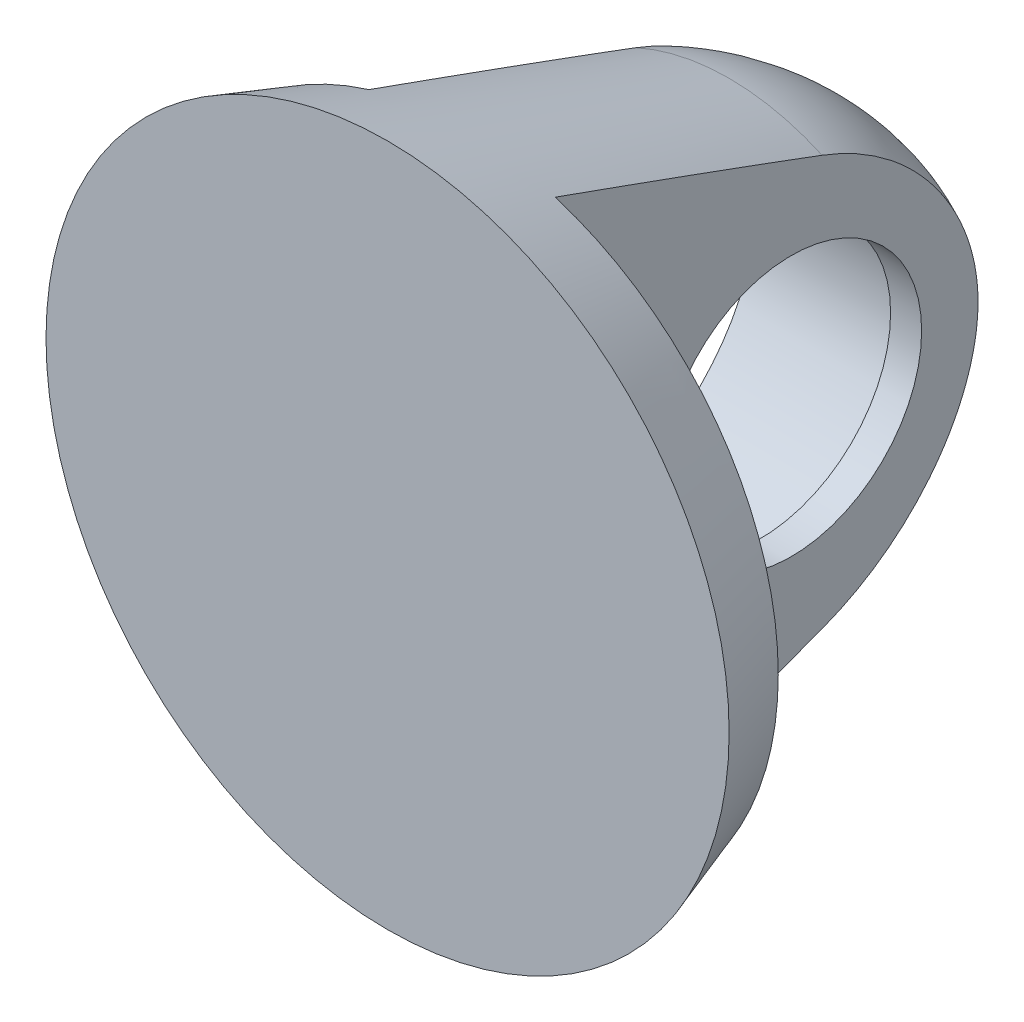
from build123d import *

# Parameters (mm, degrees)
CUT_EXTRUDE3_DEPTH      = 94.714200157
CUT_EXTRUDE3_DEPTH_BACK = 94.714200157
SKETCH2_OUTSIDE_W       = 147.454
SKETCH2_OUTSIDE_H       = 122.454
CUT_EXTRUDE8_DEPTH      = 104.234448277
CUT_EXTRUDE8_DEPTH_BACK = 104.234448277
SKETCH3_R               = 21
CUT_EXTRUDE14_START     = 10
CUT_EXTRUDE14_DEPTH     = 104.714200157


with BuildPart() as part:
    # Sketch1 → Revolve1 (revolve)
    with BuildSketch(Plane(origin=(0, 0, 0), x_dir=(1, 0, 0), z_dir=(0, 1, 0))):
        with BuildLine():
            Line((0, -32.72810219), (-55, -32.72810219))
            Line((-55, -32.72810219), (-36.260890321, 22.239952868))
            ThreePointArc((-36.260890321, 22.239952868), (-22.371485406, 42.376602521), (0, 52.27189781))
            Line((0, 52.27189781), (0, -32.72810219))
        make_face()
    revolve(axis=Axis((0, 0, 0), (0, 0, -1)))

    # Sketch2 outside → Cut-Extrude3 (cut, two sides: drawn at the far end of the back side and taken through both)
    with BuildSketch(Plane(origin=(0, 0, 0), x_dir=(1, 0, 0), z_dir=(0, 1, 0)).offset(-CUT_EXTRUDE3_DEPTH_BACK)):
        with Locations((0, 9.772)):
            Rectangle(SKETCH2_OUTSIDE_W, SKETCH2_OUTSIDE_H)
        with BuildLine():
            Line((-50.98975415, -20.72810219), (-15, -20.72810219))
            Line((-15, -20.72810219), (-15, 47.368198048))
            ThreePointArc((-15, 47.368198048), (-7.717884797, 50.486538969), (0, 52.27189781))
            ThreePointArc((0, 52.27189781), (7.717884797, 50.486538969), (15, 47.368198048))
            Line((15, 47.368198048), (15, -20.72810219))
            Line((15, -20.72810219), (50.98975415, -20.72810219))
            Line((50.98975415, -20.72810219), (55, -32.72810219))
            Line((55, -32.72810219), (-55, -32.72810219))
            Line((-55, -32.72810219), (-50.98975415, -20.72810219))
        make_face(mode=Mode.SUBTRACT)
    extrude(amount=CUT_EXTRUDE3_DEPTH + CUT_EXTRUDE3_DEPTH_BACK, mode=Mode.SUBTRACT)

    # Sketch3 → Cut-Extrude8 (cut, two sides: drawn at the far end of the back side and taken through both)
    with BuildSketch(Plane.ZY.offset(15).offset(-CUT_EXTRUDE8_DEPTH_BACK)):
        with Locations((-17.269228464, 0.516650302)):
            Circle(SKETCH3_R)
    extrude(amount=CUT_EXTRUDE8_DEPTH + CUT_EXTRUDE8_DEPTH_BACK, mode=Mode.SUBTRACT)

    # Sketch7 → Cut-Extrude14 (cut, through all)
    with BuildSketch(Plane(origin=(0, 0, 0), x_dir=(0, 0, -1), z_dir=(1, 0, 0)).offset(CUT_EXTRUDE14_START)):
        with BuildLine():
            ThreePointArc((-4.085933771, 28.189929502), (-1.548795445, 25.245464715), (-2.710158338, 21.536262644))
            ThreePointArc((-2.710158338, 21.536262644), (-11.729419852, 0.23665772), (-2.300567193, -20.884823898))
            ThreePointArc((-2.300567193, -20.884823898), (-1.06528221, -24.557293808), (-3.521841962, -27.553671356))
            Line((-3.521841962, -27.553671356), (-18.70530337, -33.591269227))
            Line((-18.70530337, -33.591269227), (-18.805959209, -41.591269227))
            add(Edge.make_bspline(
                [(-18.805959209, -41.591269227), (-11.621505265, -39.021551258), (-4.443002454, -36.435132045), (8.537377096, -31.701644614), (14.342413337, -29.563295002), (21.578912134, -26.853591679), (22.971602008, -26.224678156), (25.659513731, -24.795184881), (26.954661879, -23.994475323), (28.822242891, -22.661068012), (29.433956478, -22.193224953), (30.62347031, -21.217948833), (31.198470907, -20.712998995), (32.865569057, -19.147410526), (33.9000397, -18.036275428), (35.811549459, -15.676053439), (36.689184972, -14.427182847), (38.269084599, -11.776997767), (38.952187227, -10.408929957), (39.80553517, -8.287926833), (40.061207468, -7.569351316), (40.50978708, -6.106955425), (40.702882561, -5.361346217), (41.174798735, -3.093273216), (41.338706617, -1.574417196), (41.343762677, 0.714744198), (41.3054337, 1.479605471), (41.187672355, 2.629619722), (41.138237327, 3.014107105), (41.020785646, 3.775885762), (40.952720794, 4.154080205), (40.568043476, 6.032253798), (40.119710424, 7.494223356), (39.266070718, 9.634907486), (38.949711514, 10.342050385), (38.267936782, 11.718265772), (37.902070364, 12.389500506), (36.734878812, 14.356196195), (35.864254542, 15.604846665), (34.426659651, 17.388889116), (33.925427397, 17.968686339), (32.878276683, 19.09809595), (32.335391187, 19.644358897), (30.662848983, 21.217781035), (29.484617251, 22.185099254), (27.625202083, 23.517167772), (26.990040569, 23.941357156), (25.688535129, 24.749462638), (25.020606267, 25.134208109), (22.981633782, 26.220832832), (21.579906476, 26.853219348), (20.135924381, 27.393917715)],
                knots=[-0.116697058, -0.116697058, -0.116697058, -0.116697058, 0.5, 0.5, 1, 1, 1.124534824, 1.124534824, 1.249069647, 1.249069647, 1.311337059, 1.311337059, 1.373604471, 1.373604471, 1.498139295, 1.498139295, 1.622674119, 1.622674119, 1.747208942, 1.747208942, 1.809476354, 1.809476354, 1.871743766, 1.871743766, 1.99627859, 1.99627859, 2.058546002, 2.058546002, 2.089679708, 2.089679708, 2.120813414, 2.120813414, 2.245348237, 2.245348237, 2.307615649, 2.307615649, 2.369883061, 2.369883061, 2.494417885, 2.494417885, 2.556685297, 2.556685297, 2.618952709, 2.618952709, 2.743487532, 2.743487532, 2.805754944, 2.805754944, 2.868022356, 2.868022356, 2.99255718, 2.99255718, 2.99255718, 2.99255718], degree=3))
            add(Edge.make_bspline(
                [(20.135924381, 27.393917715), (14.342417583, 29.563293412), (8.537365103, 31.701648906), (-4.096466757, 36.308762694), (-10.92747016, 38.771416797), (-17.764048764, 41.218467815)],
                knots=[0, 0, 0, 0, 0.5, 0.5, 1.086884141, 1.086884141, 1.086884141, 1.086884141], degree=3))
            Line((-17.764048764, 41.218467815), (-17.864252473, 33.254402547))
            Line((-17.864252473, 33.254402547), (-4.085933771, 28.189929502))
        make_face()
    extrude(amount=-CUT_EXTRUDE14_DEPTH, mode=Mode.SUBTRACT)


solid = part.part
